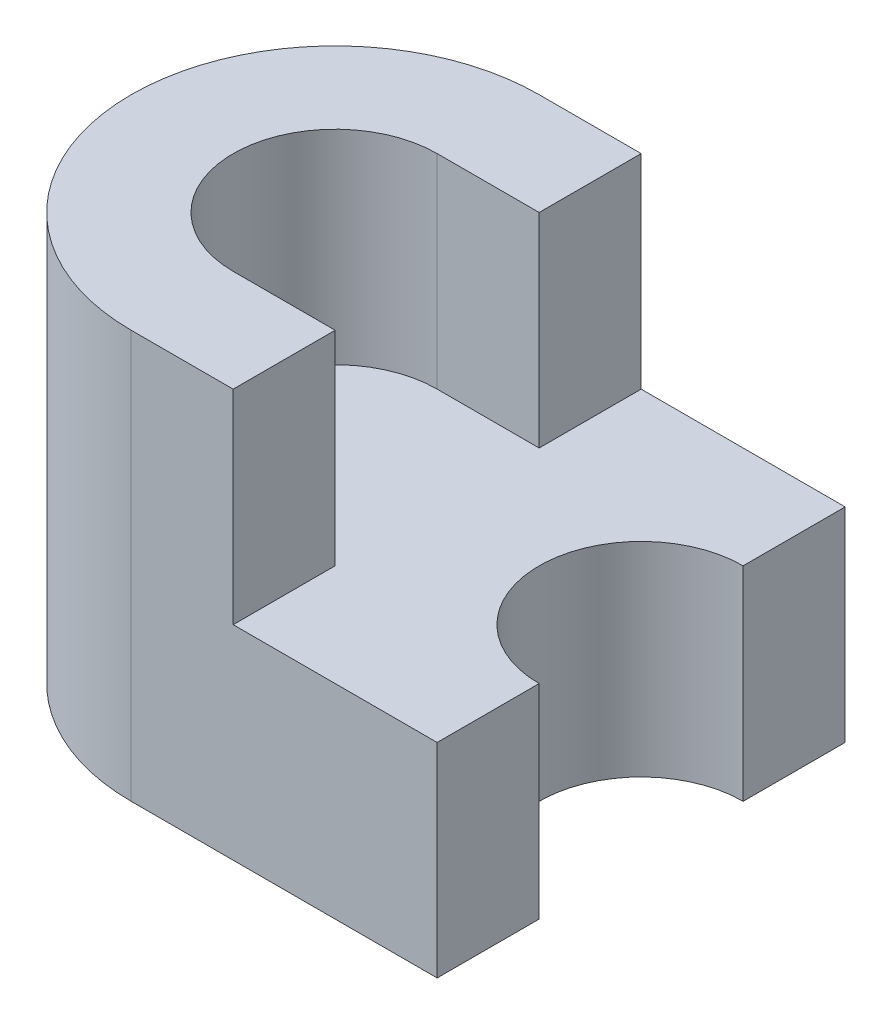
from build123d import *

# Parameters (mm, degrees)
SKETCH1_W               = 50
SKETCH1_H               = 40
BOSS_EXTRUDE2_DEPTH     = 40
CUT_EXTRUDE1_DEPTH      = 76.498344353
SKETCH10_W              = 19.997747944
SKETCH10_H              = 40
CUT_EXTRUDE2_DEPTH      = 20
SKETCH12_W              = 10
SKETCH12_H              = 20
CUT_EXTRUDE3_DEPTH      = 20
CUT_EXTRUDE6_DEPTH      = 76.498344353
CUT_EXTRUDE6_DEPTH_BACK = 20
FILLET3_R               = 20


with BuildPart() as part:
    # Sketch1 → Boss-Extrude2 (new body)
    with BuildSketch(Plane(origin=(0, 0, 0), x_dir=(1, 0, 0), z_dir=(0, 1, 0))):
        with Locations((25, 20)):
            Rectangle(SKETCH1_W, SKETCH1_H)
    extrude(amount=BOSS_EXTRUDE2_DEPTH)

    # circle → Cut-Extrude1 (cut, through all)
    with BuildSketch(Plane(origin=(0, 0, 0), x_dir=(-1, 0, 0), z_dir=(0, -1, 0))):
        with BuildLine():
            Line((-50, 10), (-50, 30))
            ThreePointArc((-50, 30), (-40, 20), (-50, 10))
        make_face()
    extrude(amount=-CUT_EXTRUDE1_DEPTH, mode=Mode.SUBTRACT)

    # Sketch10 → Cut-Extrude2 (cut)
    with BuildSketch(Plane(origin=(0, 40, 0), x_dir=(1, 0, 0), z_dir=(0, 1, 0))):
        with Locations((40.001126028, 20)):
            Rectangle(SKETCH10_W, SKETCH10_H)
    extrude(amount=-CUT_EXTRUDE2_DEPTH, mode=Mode.SUBTRACT)

    # Sketch12 → Cut-Extrude3 (cut)
    with BuildSketch(Plane(origin=(0, 40, 0), x_dir=(1, 0, 0), z_dir=(0, 1, 0))):
        with Locations((25.002252056, 20)):
            Rectangle(SKETCH12_W, SKETCH12_H)
    extrude(amount=-CUT_EXTRUDE3_DEPTH, mode=Mode.SUBTRACT)

    # Sketch14 → Cut-Extrude6 (cut, two sides: drawn at the far end of the back side and taken through both)
    with BuildSketch(Plane(origin=(0, 40, 0), x_dir=(1, 0, 0), z_dir=(0, 1, 0)).offset(-CUT_EXTRUDE6_DEPTH_BACK)):
        with BuildLine():
            Line((114.85188097, 10), (20.002252056, 10))
            ThreePointArc((20.002252056, 10), (10.002252056, 20), (20.002252056, 30))
            Line((20.002252056, 30), (114.85188097, 30))
            Line((114.85188097, 30), (304.551138797, 30))
            Line((304.551138797, 30), (304.551138797, 10))
            Line((304.551138797, 10), (114.85188097, 10))
        make_face()
    extrude(amount=CUT_EXTRUDE6_DEPTH + CUT_EXTRUDE6_DEPTH_BACK, mode=Mode.SUBTRACT)

    # Fillet3
    fillet3_edges = [part.edges().sort_by_distance(p)[0] for p in [
        (0, 20, -40),
        (0, 20, 0),
    ]]
    fillet(fillet3_edges, radius=FILLET3_R - 0.0001)  # a hair under: the kernel refuses the full size


solid = part.part
